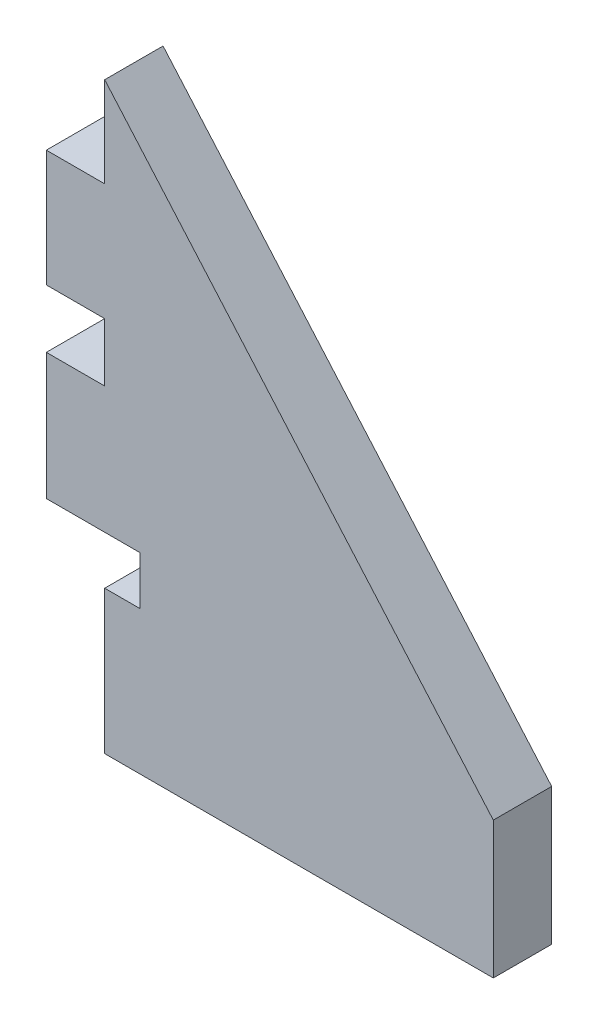
from build123d import *

# Parameters (mm, degrees)
BOSS_EXTRUDE1_DEPTH = 6.35


with BuildPart() as part:
    # Sketch1 → Boss-Extrude1 (new body)
    with BuildSketch(Plane.XY):
        Polygon((-12.346676125, 38.1), (-18.696676125, 38.1), (-18.696676125, 25.4), (-12.346676125, 25.4), (-12.346676125, 19.05), (-18.696676125, 19.05), (-18.696676125, 5.2705), (-12.346676125, 5.2705), (-8.522635097, 5.2705), (-8.522635097, 0), (-12.346676125, 0), (-12.346676125, -15.5875), (29.935330231, -15.5875), (29.935330231, -0.710514446), (-12.346676125, 47.9125), align=None)
    extrude(amount=BOSS_EXTRUDE1_DEPTH)


solid = part.part
